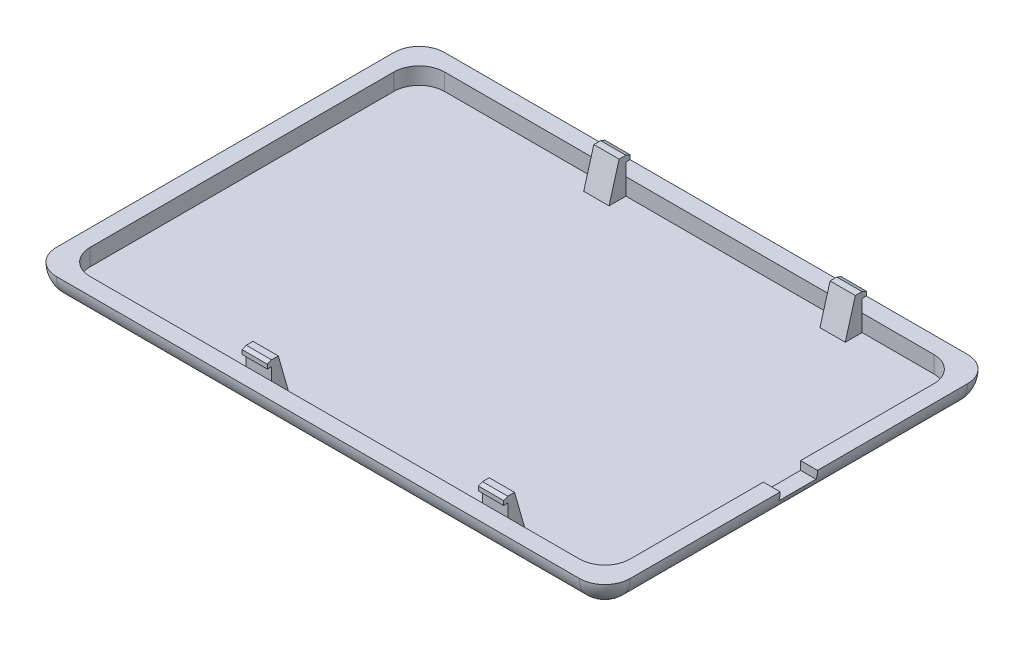
from build123d import *

# Parameters (mm, degrees)
SKETCH1_W           = 68
SKETCH1_H           = 46
BOSS_EXTRUDE1_DEPTH = 3
SKETCH2_W           = 64
SKETCH2_H           = 42
CUT_EXTRUDE1_DEPTH  = 2
SNAP_START          = 17.5
SNAP_HOOK1_DEPTH    = 3
SNAP_START_2        = -10.5
SNAP_HOOK2_DEPTH    = 3
FILLET3_R           = 3
FILLET4_R           = 3
FILLET5_R           = 3
SKETCH4_W           = 2.752193097
SKETCH4_H           = 4.417994182
CUT_EXTRUDE2_DEPTH  = 1


# Read off the part's stored shape, not the designer's step: Snap Hook1, Snap Hook2
# Some blends are built 0.0001 mm under size
with BuildPart() as part:
    # Sketch1 → Boss-Extrude1 (new body)
    with BuildSketch(Plane(origin=(0, 0, 0), x_dir=(1, 0, 0), z_dir=(0, 1, 0))):
        Rectangle(SKETCH1_W, SKETCH1_H)
    extrude(amount=BOSS_EXTRUDE1_DEPTH)

    # Sketch2 → Cut-Extrude1 (cut)
    with BuildSketch(Plane(origin=(0, 3, 0), x_dir=(1, 0, 0), z_dir=(0, 1, 0))):
        Rectangle(SKETCH2_W, SKETCH2_H)
    extrude(amount=-CUT_EXTRUDE1_DEPTH, mode=Mode.SUBTRACT)

    # Snap Hook1 outline → Snap Hook1 (add)
    with BuildSketch(Plane.YZ.offset(SNAP_START)):
        Polygon((5, -21.5), (5.2, -21), (5.2, -20.2), (1, -19), (1, -21), (4.5, -21), (4.5, -21.5), align=None)
    snap_hook1 = extrude(amount=SNAP_HOOK1_DEPTH)

    # Snap Hook2 outline → Snap Hook2 (add)
    with BuildSketch(Plane.YZ.offset(SNAP_START_2)):
        Polygon((5, -21.5), (5.2, -21), (5.2, -20.2), (1, -19), (1, -21), (4.5, -21), (4.5, -21.5), align=None)
    snap_hook2 = extrude(amount=SNAP_HOOK2_DEPTH)

    # Mirror1: Snap Hook1, Snap Hook2 across plane
    add(snap_hook1.mirror(Plane.XY))
    add(snap_hook2.mirror(Plane.XY))

    # Fillet3
    fillet3_edges = [part.edges().sort_by_distance(p)[0] for p in [
        (0, 0, -23),
        (34, 0, 0),
        (0, 0, 23),
        (-34, 0, 0),
    ]]
    fillet(fillet3_edges, radius=FILLET3_R - 0.0001)  # a hair under: the kernel refuses the full size

    # Fillet4
    # the kernel refuses this fillet: 3 mm, written as the material it takes off along each edge
    with BuildSketch(Plane(origin=(31, 0, 20), x_dir=(1, 0, 0), z_dir=(0, 0, -1))) as fillet4_piece_1:
        with BuildLine():
            CenterArc((0.0001, -2.9999), 2.9999, 0, 90)
            Line((3, -2.9999), (3, 0))
            Line((3, 0), (0.0001, 0))
        make_face()
    revolve(axis=Axis((31, 0, 20), (0, -1, 0)), revolution_arc=90, mode=Mode.SUBTRACT)
    with BuildSketch(Plane(origin=(-31, 0, 20), x_dir=(0, 0, 1), z_dir=(1, 0, 0))) as fillet4_piece_2:
        with BuildLine():
            CenterArc((0.0001, -2.9999), 2.9999, 0, 90)
            Line((3, -2.9999), (3, 0))
            Line((3, 0), (0.0001, 0))
        make_face()
    revolve(axis=Axis((-31, 0, 20), (0, -1, 0)), revolution_arc=90, mode=Mode.SUBTRACT)
    with BuildSketch(Plane(origin=(31, 0, -20), x_dir=(0, 0, -1), z_dir=(-1, 0, 0))) as fillet4_piece_3:
        with BuildLine():
            CenterArc((0.0001, -2.9999), 2.9999, 0, 90)
            Line((3, -2.9999), (3, 0))
            Line((3, 0), (0.0001, 0))
        make_face()
    revolve(axis=Axis((31, 0, -20), (0, -1, 0)), revolution_arc=90, mode=Mode.SUBTRACT)
    with BuildSketch(Plane(origin=(-31, 0, -20), x_dir=(-1, 0, 0), z_dir=(0, 0, 1))) as fillet4_piece_4:
        with BuildLine():
            CenterArc((0.0001, -2.9999), 2.9999, 0, 90)
            Line((3, -2.9999), (3, 0))
            Line((3, 0), (0.0001, 0))
        make_face()
    revolve(axis=Axis((-31, 0, -20), (0, -1, 0)), revolution_arc=90, mode=Mode.SUBTRACT)
    with BuildSketch(Plane(origin=(-34, 0, -23), x_dir=(0, 0, 1), z_dir=(0, 1, 0)), Plane(origin=(-34, 0, 23), x_dir=(1, 0, 0), z_dir=(0, 1, 0))) as fillet4_piece_5:
        with BuildLine():
            CenterArc((FILLET4_R, FILLET4_R), FILLET4_R, 180, 90)
            Line((0, FILLET4_R), (0, 0))
            Line((0, 0), (FILLET4_R, 0))
        make_face()
    extrude(amount=10.5, mode=Mode.SUBTRACT)
    with BuildSketch(Plane(origin=(34, 0, -23), x_dir=(0, 0, 1), z_dir=(0, 1, 0)), Plane(origin=(34, 0, 23), x_dir=(-1, 0, 0), z_dir=(0, 1, 0))) as fillet4_piece_6:
        with BuildLine():
            CenterArc((FILLET4_R, -FILLET4_R), FILLET4_R, 90, 90)
            Line((0, -FILLET4_R), (0, 0))
            Line((0, 0), (FILLET4_R, 0))
        make_face()
    extrude(amount=10.5, mode=Mode.SUBTRACT)

    # Fillet5
    fillet5_edges = [part.edges().sort_by_distance(p)[0] for p in [
        (-32, 2, 21),
        (-32, 2, -21),
        (32, 2, -21),
        (32, 2, 21),
    ]]
    fillet(fillet5_edges, radius=FILLET5_R)

    # Sketch4 → Cut-Extrude2 (cut)
    with BuildSketch(Plane(origin=(0, 3, 0), x_dir=(1, 0, 0), z_dir=(0, 1, 0))):
        with Locations((33.0987433, 0)):
            Rectangle(SKETCH4_W, SKETCH4_H)
    extrude(amount=-CUT_EXTRUDE2_DEPTH, mode=Mode.SUBTRACT)


solid = part.part
